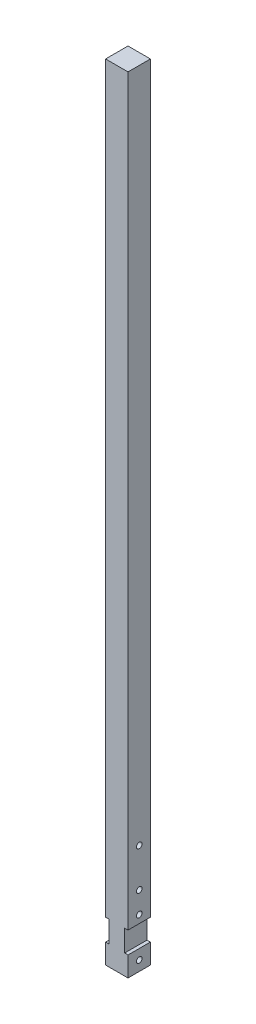
from build123d import *

# Parameters (mm, degrees)
ESQUISSE1_W             = 10
ESQUISSE1_H             = 10
BOSS_EXTRU_1_DEPTH      = 350
TROU_TARAUD_M3X0_51_D   = 2.5
ESQUISSE4_W             = 1.5
ESQUISSE4_H             = 9.6
ENL_V_MAT_EXTRU_1_DEPTH = 351.178525898


with BuildPart() as part:
    # Esquisse1 → Boss.-Extru.1 (new body)
    with BuildSketch(Plane(origin=(0, 0, 0), x_dir=(1, 0, 0), z_dir=(0, 1, 0))):
        Rectangle(ESQUISSE1_W, ESQUISSE1_H)
    extrude(amount=BOSS_EXTRU_1_DEPTH)

    # Trou taraudé M3x0.51 (through all)
    with Locations(Plane.ZY.offset(5)):
        with Locations((0, 22), (0, 4.45), (0, 31.5), (0, 48.7)):
            Hole(TROU_TARAUD_M3X0_51_D / 2)

    # Esquisse4 → Enlèv. mat.-Extru.1 (cut, through all)
    with BuildSketch(Plane(origin=(0, 0, -5), x_dir=(-1, 0, 0), z_dir=(0, 0, -1))):
        with Locations((4.25, 13.7)):
            Rectangle(ESQUISSE4_W, ESQUISSE4_H)
        with Locations((-4.25, 13.7)):
            Rectangle(ESQUISSE4_W, ESQUISSE4_H)
    extrude(amount=-ENL_V_MAT_EXTRU_1_DEPTH, mode=Mode.SUBTRACT)


solid = part.part
